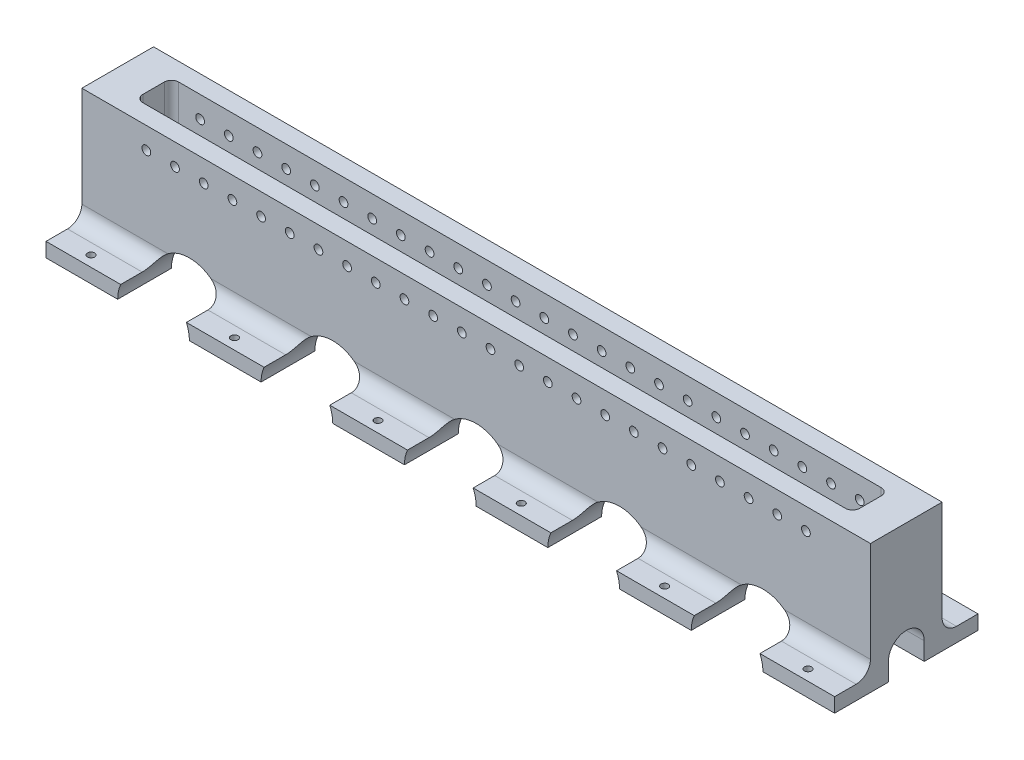
from build123d import *

# Parameters (mm, degrees)
SKETCH1_W           = 110
SKETCH1_H           = 10
SKETCH1_W_2         = 100
SKETCH1_H_2         = 5
BOSS_EXTRUDE1_DEPTH = 18
SKETCH2_W           = 5
SKETCH2_H           = 5
CUT_EXTRUDE1_DEPTH  = 112.575086825
FILLET1_R           = 2.5
SKETCH3_R           = 0.61
CUT_EXTRUDE2_DEPTH  = 59.72818744
LPATTERN1_COUNT     = 24
LPATTERN1_PITCH     = 4
SKETCH6_W           = 110
SKETCH6_H           = 5
BOSS_EXTRUDE2_DEPTH = 2
FILLET2_R           = 2
CUT_EXTRUDE4_DEPTH  = 60.782940711
LPATTERN2_COUNT     = 5
LPATTERN2_PITCH     = 20
SKETCH7_R           = 0.5
CUT_EXTRUDE5_DEPTH  = 2
LPATTERN3_COUNT     = 24
LPATTERN3_PITCH     = 20
FILLET3_R           = 1
BOSS_EXTRUDE3_DEPTH = 1
LPATTERN4_COUNT     = 4
LPATTERN4_PITCH     = 20


with BuildPart() as part:
    # Sketch1 → Boss-Extrude1 (new body)
    with BuildSketch(Plane(origin=(0, 0, 0), x_dir=(1, 0, 0), z_dir=(0, 1, 0))):
        Rectangle(SKETCH1_W, SKETCH1_H)
        Rectangle(SKETCH1_W_2, SKETCH1_H_2, mode=Mode.SUBTRACT)
    extrude(amount=BOSS_EXTRUDE1_DEPTH)

    # Sketch2 → Cut-Extrude1 (cut, through all)
    with BuildSketch(Plane(origin=(55, 0, 0), x_dir=(0, 0, -1), z_dir=(1, 0, 0))):
        with Locations((0, 2.5)):
            Rectangle(SKETCH2_W, SKETCH2_H)
    extrude(amount=-CUT_EXTRUDE1_DEPTH, mode=Mode.SUBTRACT)

    # Fillet1
    fillet1_edges = [part.edges().sort_by_distance(p)[0] for p in [
        (52.5, 5, 2.5),
        (52.5, 5, -2.5),
        (-52.5, 5, -2.5),
        (-52.5, 5, 2.5),
    ]]
    fillet(fillet1_edges, radius=FILLET1_R - 0.0001)  # a hair under: the kernel refuses the full size

    # Sketch3 → Cut-Extrude2 (cut, through all)
    with BuildSketch(Plane.XY.offset(5)):
        with Locations((-46, 15)):
            Circle(SKETCH3_R)
    cut_extrude2 = extrude(amount=-CUT_EXTRUDE2_DEPTH, mode=Mode.SUBTRACT)

    # LPattern1: Cut-Extrude2 ×24
    with Locations(*[(i * LPATTERN1_PITCH, 0, 0) for i in range(1, LPATTERN1_COUNT)]):
        add(cut_extrude2, mode=Mode.SUBTRACT)

    # Sketch6 → Boss-Extrude2 (add)
    with BuildSketch(Plane.XZ):
        with Locations((0, -7.5)):
            Rectangle(SKETCH6_W, SKETCH6_H)
        with Locations((0, 7.5)):
            Rectangle(SKETCH6_W, SKETCH6_H)
    extrude(amount=-BOSS_EXTRUDE2_DEPTH)

    # Fillet2
    fillet2_edges = [part.edges().sort_by_distance(p)[0] for p in [
        (0, 2, -5),
        (0, 2, 5),
    ]]
    fillet(fillet2_edges, radius=FILLET2_R)

    # Sketch5 → Cut-Extrude4 (cut, symmetric)
    with BuildSketch(Plane.XY.offset(5)):
        with BuildLine():
            Line((-45, 0), (-35, 0))
            ThreePointArc((-35, 0), (-40, 5), (-45, 0))
        make_face()
    cut_extrude4 = extrude(amount=CUT_EXTRUDE4_DEPTH, both=True, mode=Mode.SUBTRACT)

    # LPattern2: Cut-Extrude4 ×5
    with Locations(*[(i * LPATTERN2_PITCH, 0, 0) for i in range(1, LPATTERN2_COUNT)]):
        add(cut_extrude4, mode=Mode.SUBTRACT)

    # Sketch7 → Cut-Extrude5 (cut)
    with BuildSketch(Plane(origin=(0, 2, 0), x_dir=(1, 0, 0), z_dir=(0, 1, 0))):
        with Locations(Location((49.791287847, 8.5, 0), (0, 0, 270))):
            Circle(SKETCH7_R)
        with Locations(Location((49.791287847, -8.5, 0), (0, 0, 270))):
            Circle(SKETCH7_R)
    cut_extrude5 = extrude(amount=-CUT_EXTRUDE5_DEPTH, mode=Mode.SUBTRACT)

    # LPattern3: Cut-Extrude5 ×24
    with Locations(*[(-i * LPATTERN3_PITCH, 0, 0) for i in range(1, LPATTERN3_COUNT)]):
        add(cut_extrude5, mode=Mode.SUBTRACT)

    # Fillet3
    fillet3_edges = [part.edges().sort_by_distance(p)[0] for p in [
        (50, 10.25005, 2.5),
        (50, 10.25005, -2.5),
        (-50, 10.25005, -2.5),
        (-50, 10.25005, 2.5),
    ]]
    fillet(fillet3_edges, radius=FILLET3_R)

    # Sketch9 → Boss-Extrude3 (add, symmetric)
    with BuildSketch(Plane.ZY.offset(-30)):
        with BuildLine():
            Line((2.5, 5.5), (2.5, 3))
            ThreePointArc((2.5, 3), (1.767766953, 4.767766953), (0, 5.5))
            ThreePointArc((0, 5.5), (-1.767766953, 4.767766953), (-2.5, 3))
            Line((-2.5, 3), (-2.5, 5.5))
            Line((-2.5, 5.5), (-2.5, 8.5))
            Line((-2.5, 8.5), (0, 8.5))
            Line((0, 8.5), (2.5, 8.5))
            Line((2.5, 8.5), (2.5, 5.5))
        make_face()
    boss_extrude3 = extrude(amount=BOSS_EXTRUDE3_DEPTH, both=True)

    # LPattern4: Boss-Extrude3 ×4
    with Locations(*[(-i * LPATTERN4_PITCH, 0, 0) for i in range(1, LPATTERN4_COUNT)]):
        add(boss_extrude3)


solid = part.part
